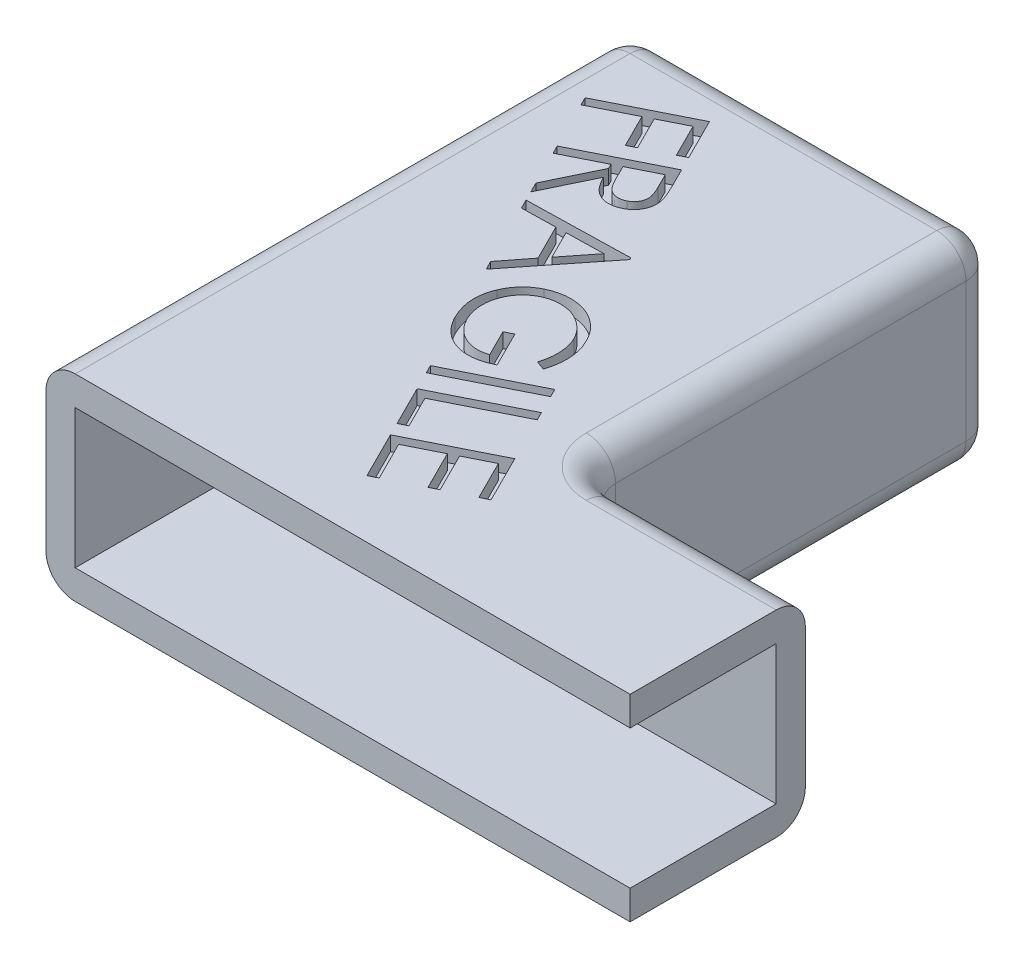
from build123d import *

# Parameters (mm, degrees)
BOSS_EXTRUDE1_DEPTH = 6.75
CUT_EXTRUDE3_DEPTH  = 4.75
CUT_EXTRUDE4_DEPTH  = 1
FILLET1_R           = 2


with BuildPart() as part:
    # Sketch1 → Boss-Extrude1 (new body)
    with BuildSketch(Plane(origin=(0, 0, 0), x_dir=(1, 0, 0), z_dir=(0, 1, 0))):
        Polygon((0, 0), (0, 40), (25, 40), (25, 12), (40, 12), (40, 0), align=None)
    extrude(amount=BOSS_EXTRUDE1_DEPTH)

    # Sketch4 → Cut-Extrude3 (cut)
    with BuildSketch(Plane(origin=(0, 6.75, 0), x_dir=(1, 0, 0), z_dir=(0, 1, 0))):
        Polygon((2, 0), (2, 38), (23, 38), (23, 10), (40, 10), (40, 0), align=None)
    extrude(amount=-CUT_EXTRUDE3_DEPTH, mode=Mode.SUBTRACT)

    # Mirror2: part across plane


with BuildPart() as part_1:
    add(part.part)
    add(part.part.mirror(Plane(origin=(0, 6.75, 0), x_dir=(0, 0, 1), z_dir=(0, -1, 0))))

    # Sketch5 → Cut-Extrude4 (cut)
    # profile 1 of 7: a face of its own
    with BuildSketch(Plane(origin=(0, 13.5, 0), x_dir=(1, 0, 0), z_dir=(0, 1, 0))):
        Polygon((8.754647989, 36.676441202), (10.178055441, 33.834714439), (9.618359928, 33.554866683), (8.476072268, 35.834353862), (6.70285512, 34.946473253), (7.845142781, 32.666986074), (7.286719303, 32.387138317), (6.144431643, 34.666625497), (3.363762572, 33.273746891), (3.082642781, 33.835986474), align=None)
    # profile 2 of 7: a face of its own
    with BuildSketch(Plane(origin=(0, 13.5, 0), x_dir=(1, 0, 0), z_dir=(0, 1, 0))):
        with BuildLine():
            Line((10.663116633, 32.859503914), (11.229172322, 31.729936606))
            add(Edge.make_bspline(
                [(11.229172322, 31.729936606), (11.266586985, 31.654088797), (11.338147563, 31.509019656), (11.43932601, 31.299868335), (11.527962053, 31.10862173), (11.605323099, 30.935170326), (11.66833747, 30.779069763), (11.721174546, 30.641068423), (11.762750594, 30.521309586), (11.782478155, 30.446146264), (11.791411905, 30.41210808)],
                knots=[0, 0, 0, 0, 1.41450932, 2.705439416, 3.885743353, 4.939894687, 5.88148064, 6.700709836, 7.411608266, 8, 8, 8, 8], degree=3))
            add(Edge.make_bspline(
                [(11.791411905, 30.41210808), (11.802078497, 30.365630207), (11.823164297, 30.273752393), (11.838529948, 30.134733419), (11.845179328, 29.997925908), (11.842052212, 29.862526855), (11.82519631, 29.728870174), (11.796602124, 29.59723127), (11.758960623, 29.467152066), (11.708795108, 29.34027056), (11.650082636, 29.216822164), (11.578255624, 29.100872669), (11.496173347, 28.992182486), (11.404631487, 28.890039122), (11.301895564, 28.795763665), (11.189713099, 28.707401745), (11.066119773, 28.627110327), (10.977709577, 28.580939966), (10.932788107, 28.557480677)],
                knots=[0, 0, 0, 0, 1.030585874, 2.037270015, 3.019599379, 3.992076591, 4.962346036, 5.928228341, 6.903253401, 7.887592627, 8.876066943, 9.855953285, 10.831711236, 11.818738111, 12.818127647, 13.843641548, 14.904348217, 16, 16, 16, 16], degree=3))
            add(Edge.make_bspline(
                [(10.932788107, 28.557480677), (10.856454784, 28.522262049), (10.707628602, 28.453596704), (10.473952914, 28.388384974), (10.240978344, 28.357148809), (10.009394291, 28.360860036), (9.782806133, 28.399022554), (9.564210464, 28.47223192), (9.356563374, 28.581115364), (9.192877181, 28.697721344), (9.067809177, 28.809883022), (8.972867756, 28.90747829), (8.879484633, 29.0179465), (8.786870292, 29.140762985), (8.693027373, 29.274443582), (8.602772322, 29.422432801), (8.510240394, 29.581209607), (8.452657249, 29.69312905), (8.423062546, 29.750649747)],
                knots=[0, 0, 0, 0, 1.275491154, 2.486810117, 3.669320756, 4.835400704, 5.991815185, 7.146793527, 8.32226535, 9.541335358, 10.189151225, 10.872441073, 11.608160371, 12.3850279, 13.208790561, 14.088244423, 15.017458352, 16, 16, 16, 16], degree=3))
            Line((8.423062546, 29.750649747), (6.807577771, 26.391204635))
            Line((6.807577771, 26.391204635), (6.45649604, 27.092096061))
            Line((6.45649604, 27.092096061), (8.074524886, 30.448997103))
            Line((8.074524886, 30.448997103), (7.911704373, 30.773366093))
            Line((7.911704373, 30.773366093), (5.274775287, 29.452993497))
            Line((5.274775287, 29.452993497), (4.991111425, 30.019049186))
            Line((4.991111425, 30.019049186), (10.663116633, 32.859503914))
        make_face()
        with BuildLine():
            Line((10.390901088, 32.014872503), (8.463767675, 31.050669779))
            Line((8.463767675, 31.050669779), (8.944597001, 30.071202632))
            add(Edge.make_bspline(
                [(8.944597001, 30.071202632), (8.967576086, 30.025652442), (9.012186541, 29.937223562), (9.082335332, 29.812210508), (9.149400048, 29.697211119), (9.215632114, 29.593373224), (9.281604355, 29.501287469), (9.345213553, 29.418592172), (9.408469027, 29.347945758), (9.488986395, 29.26818611), (9.595471686, 29.187177825), (9.73147041, 29.111276193), (9.877342294, 29.059576057), (10.029147171, 29.030867772), (10.184498247, 29.023712426), (10.338901778, 29.043049787), (10.49173409, 29.081153967), (10.587800696, 29.125346571), (10.636403892, 29.147705036)],
                knots=[0, 0, 0, 0, 1.114428451, 2.163496172, 3.130994844, 4.022616522, 4.852843401, 5.605155819, 6.30056977, 6.922856548, 8.078968302, 9.210815528, 10.312466522, 11.444275841, 12.575326779, 13.694442081, 14.833543843, 16, 16, 16, 16], degree=3))
            add(Edge.make_bspline(
                [(10.636403892, 29.147705036), (10.682233319, 29.172610636), (10.772650602, 29.221747116), (10.892059351, 29.319083053), (10.994641245, 29.432382187), (11.080552506, 29.559146488), (11.148865679, 29.69558941), (11.191294371, 29.839107224), (11.214728754, 29.985543074), (11.211325068, 30.110694902), (11.198057955, 30.216416148), (11.178287168, 30.304628708), (11.151505117, 30.401967801), (11.115496795, 30.50758511), (11.070559549, 30.621825876), (11.01824134, 30.745185499), (10.95866008, 30.877828215), (10.914010652, 30.968131486), (10.890810944, 31.015052792)],
                knots=[0, 0, 0, 0, 1.162087497, 2.292692764, 3.418137779, 4.562520382, 5.700979498, 6.808619015, 7.889994426, 8.997350933, 9.588933592, 10.266395831, 11.012550037, 11.841485571, 12.75530961, 13.75187071, 14.831878838, 16, 16, 16, 16], degree=3))
            Line((10.890810944, 31.015052792), (10.390901088, 32.014872503))
        make_face(mode=Mode.SUBTRACT)
    # profile 3 of 7: a face of its own
    with BuildSketch(Plane(origin=(0, 13.5, 0), x_dir=(1, 0, 0), z_dir=(0, 1, 0))):
        Polygon((14.210861413, 25.767830459), (9.864316942, 20.281542398), (9.559028481, 20.890847286), (10.978619827, 22.716217878), (9.75492191, 25.161069641), (7.444905884, 25.112732302), (7.128169106, 25.744933824), (14.140899474, 25.906482302), align=None)
        Polygon((12.973171109, 25.233575651), (10.430372631, 25.181422205), (11.400935532, 23.241568439), align=None, mode=Mode.SUBTRACT)
    # profile 4 of 7: a face of its own
    with BuildSketch(Plane(origin=(0, 13.5, 0), x_dir=(1, 0, 0), z_dir=(0, 1, 0))):
        with BuildLine():
            Line((17.750596673, 16.310926045), (17.114579045, 16.542436461))
            add(Edge.make_bspline(
                [(17.114579045, 16.542436461), (17.149504314, 16.659314385), (17.218383693, 16.889820228), (17.281073393, 17.241206897), (17.310888701, 17.589529275), (17.307254009, 17.93290052), (17.271246017, 18.265225386), (17.210000777, 18.582208617), (17.11787488, 18.880202133), (17.033022024, 19.066098534), (16.991191625, 19.157740949)],
                knots=[0, 0, 0, 0, 1.090643464, 2.150959598, 3.186474562, 4.214576681, 5.217906055, 6.17316086, 7.099412641, 8, 8, 8, 8], degree=3))
            add(Edge.make_bspline(
                [(16.991191625, 19.157740949), (16.962702997, 19.212451788), (16.905784408, 19.321760799), (16.80702033, 19.477218985), (16.701772172, 19.62730822), (16.585112078, 19.768760942), (16.459449985, 19.903527569), (16.323882955, 20.030877731), (16.18025152, 20.151910087), (16.028317088, 20.264726825), (15.869967846, 20.367022324), (15.707955581, 20.459247033), (15.542779408, 20.539409323), (15.374179228, 20.607467496), (15.20213136, 20.661642415), (15.027695946, 20.705542814), (14.849879754, 20.735777125), (14.670146272, 20.754770336), (14.490442881, 20.762258655), (14.312740681, 20.759117414), (14.138654213, 20.741760214), (13.96769399, 20.715634301), (13.800255752, 20.677127853), (13.635877855, 20.627236557), (13.473990084, 20.566840744), (13.36978921, 20.517060522), (13.317553805, 20.492105933)],
                knots=[0, 0, 0, 0, 1.023602203, 2.045096457, 3.054881536, 4.065255296, 5.086240082, 6.112042517, 7.151234627, 8.202916022, 9.251412248, 10.279072739, 11.295972597, 12.297257131, 13.294599634, 14.288233837, 15.281169632, 16.286306795, 17.286774449, 18.265460265, 19.234171694, 20.188946326, 21.134961851, 22.083618823, 23.03932717, 24, 24, 24, 24], degree=3))
            add(Edge.make_bspline(
                [(13.317553805, 20.492105933), (13.265012063, 20.464386326), (13.160538746, 20.409269019), (13.011184451, 20.314614923), (12.86960337, 20.209598543), (12.734439954, 20.095751059), (12.608667975, 19.969877214), (12.48847915, 19.836036479), (12.375376993, 19.692769005), (12.271423389, 19.539846683), (12.176260736, 19.380990231), (12.093260228, 19.215901412), (12.022126656, 19.046672178), (11.961899259, 18.87296044), (11.913866024, 18.694808579), (11.876440376, 18.512654363), (11.852785005, 18.325965406), (11.839712647, 18.13609188), (11.840164955, 17.944464904), (11.851489102, 17.753747561), (11.874222673, 17.564591967), (11.909936061, 17.377168793), (11.95877478, 17.191307097), (12.018470291, 17.006340907), (12.090728404, 16.823197938), (12.147829948, 16.704084473), (12.17653818, 16.644199282)],
                knots=[0, 0, 0, 0, 0.958373364, 1.905617186, 2.849890808, 3.801351144, 4.754507599, 5.718798181, 6.703007822, 7.697486439, 8.700800039, 9.689186917, 10.676602268, 11.661168615, 12.653762319, 13.652140774, 14.6595524, 15.688188091, 16.721387899, 17.749591108, 18.76972591, 19.793639978, 20.825910435, 21.868874541, 22.928560625, 24, 24, 24, 24], degree=3))
            add(Edge.make_bspline(
                [(12.17653818, 16.644199282), (12.214068842, 16.573210328), (12.287728414, 16.433883826), (12.414425786, 16.238536676), (12.551922826, 16.059542055), (12.701594428, 15.897175895), (12.862463217, 15.750363869), (13.033905288, 15.618831466), (13.217610105, 15.505286505), (13.40963089, 15.407416669), (13.609218029, 15.329024262), (13.811266617, 15.268846856), (14.015281353, 15.228719872), (14.220684515, 15.210139851), (14.427703659, 15.20964635), (14.635926564, 15.230631866), (14.845713573, 15.270770388), (14.983003471, 15.313573624), (15.052609894, 15.335275003)],
                knots=[0, 0, 0, 0, 1.112233068, 2.182924723, 3.221773303, 4.236313444, 5.23858161, 6.236241304, 7.225841215, 8.226937701, 9.218680529, 10.192811497, 11.144573681, 12.094593375, 13.046391827, 14.00866825, 14.990388358, 16, 16, 16, 16], degree=3))
            Line((15.052609894, 15.335275003), (14.146920792, 17.144109138))
            Line((14.146920792, 17.144109138), (14.693895952, 17.417596718))
            Line((14.693895952, 17.417596718), (15.917593869, 14.972744955))
            add(Edge.make_bspline(
                [(15.917593869, 14.972744955), (15.809404304, 14.922139968), (15.597668067, 14.823101676), (15.273973467, 14.708923582), (14.955243401, 14.626351182), (14.641771554, 14.575796604), (14.332683177, 14.559255718), (14.028543225, 14.573883546), (13.729228934, 14.622974686), (13.436783511, 14.703160629), (13.154432621, 14.813130912), (12.887790624, 14.95440471), (12.63554354, 15.121796471), (12.40192406, 15.320796978), (12.181321881, 15.545432969), (11.979433242, 15.800315708), (11.792388421, 16.082452493), (11.684673999, 16.285767958), (11.629563019, 16.389792231)],
                knots=[0, 0, 0, 0, 1.124394106, 2.200535496, 3.227236646, 4.221905612, 5.185737163, 6.137396387, 7.084115907, 8.036453592, 8.988657298, 9.931841074, 10.873298585, 11.834072463, 12.816829376, 13.834050308, 14.891814057, 16, 16, 16, 16], degree=3))
            add(Edge.make_bspline(
                [(11.629563019, 16.389792231), (11.59807253, 16.454836715), (11.535695827, 16.583677538), (11.452653598, 16.778988393), (11.383722316, 16.974646212), (11.320983228, 17.167352218), (11.273924762, 17.360779491), (11.232949137, 17.552145043), (11.20728087, 17.743568268), (11.189884775, 17.933275604), (11.18540867, 18.122306132), (11.189859413, 18.310480344), (11.206966479, 18.497711886), (11.23344002, 18.684237249), (11.271540457, 18.869925547), (11.321796107, 19.054363442), (11.380801453, 19.238289596), (11.429503602, 19.358160508), (11.454022154, 19.418508176)],
                knots=[0, 0, 0, 0, 1.10581367, 2.190407767, 3.245347638, 4.279611866, 5.289928162, 6.290130256, 7.272901491, 8.243365102, 9.204018092, 10.164671082, 11.122207412, 12.079281966, 13.046399366, 14.020673147, 15.003530055, 16, 16, 16, 16], degree=3))
            add(Edge.make_bspline(
                [(11.454022154, 19.418508176), (11.494636157, 19.509728982), (11.574858158, 19.689911062), (11.725201022, 19.941979792), (11.88968972, 20.178590118), (12.075466342, 20.39629856), (12.28112837, 20.594628863), (12.504527997, 20.776758878), (12.748532732, 20.938649372), (12.922010676, 21.031545715), (13.009721272, 21.078514186)],
                knots=[0, 0, 0, 0, 1.029893183, 2.034275993, 3.023912036, 4.001864804, 4.983063865, 5.96944254, 6.973348412, 8, 8, 8, 8], degree=3))
            add(Edge.make_bspline(
                [(13.009721272, 21.078514186), (13.07714227, 21.110848767), (13.210546799, 21.174828532), (13.417014701, 21.253523183), (13.62597772, 21.318816897), (13.838131288, 21.369279427), (14.052566323, 21.406942951), (14.269848042, 21.428027021), (14.489943074, 21.436121225), (14.711742769, 21.428000667), (14.93269239, 21.406641379), (15.150289788, 21.371091726), (15.363231796, 21.321452252), (15.571027309, 21.257639736), (15.774439491, 21.17997239), (15.972277168, 21.086472623), (16.166826566, 20.981217404), (16.354379655, 20.859824633), (16.535918218, 20.727160676), (16.708486832, 20.581371766), (16.871263362, 20.42330867), (17.025319533, 20.253691435), (17.171152684, 20.072973447), (17.305305233, 19.878738793), (17.432308337, 19.674314335), (17.506872023, 19.530545212), (17.544526962, 19.457941269)],
                knots=[0, 0, 0, 0, 1.001409127, 1.981467476, 2.957103692, 3.932607596, 4.901073092, 5.871602272, 6.854947762, 7.849647827, 8.842789463, 9.827118954, 10.801315311, 11.769847447, 12.737262772, 13.715673409, 14.699478222, 15.698516039, 16.706317444, 17.71006013, 18.722430057, 19.74384414, 20.778286389, 21.830973086, 22.90463333, 24, 24, 24, 24], degree=3))
            add(Edge.make_bspline(
                [(17.544526962, 19.457941269), (17.600687062, 19.337644206), (17.711783556, 19.099671305), (17.836788123, 18.728447901), (17.921565009, 18.351526154), (17.963525295, 18.033035785), (17.974482571, 17.775139185), (17.975278079, 17.577287318), (17.96321043, 17.375637243), (17.941430886, 17.169795592), (17.909624725, 16.960542021), (17.867540648, 16.746972509), (17.813806472, 16.52995476), (17.771850234, 16.384571908), (17.750596673, 16.310926045)],
                knots=[0, 0, 0, 0, 1.475369076, 2.918590448, 4.34484701, 5.765880787, 6.483274427, 7.214052629, 7.964889576, 8.728175752, 9.51497962, 10.317559171, 11.147734369, 12, 12, 12, 12], degree=3))
        make_face()
    # profile 5 of 7: a face of its own
    with BuildSketch(Plane(origin=(0, 13.5, 0), x_dir=(1, 0, 0), z_dir=(0, 1, 0))):
        Polygon((19.345012717, 15.495711746), (19.628676579, 14.928384022), (13.956671371, 12.087929294), (13.673007508, 12.655257018), align=None)
    # profile 6 of 7: a face of its own
    with BuildSketch(Plane(origin=(0, 13.5, 0), x_dir=(1, 0, 0), z_dir=(0, 1, 0))):
        Polygon((20.259504408, 13.666728363), (20.544440306, 13.096856568), (15.419410258, 10.52988942), (16.510816508, 8.350893026), (15.963841348, 8.077405446), (14.5874992, 10.826273635), align=None)
    # profile 7 of 7: a face of its own
    with BuildSketch(Plane(origin=(0, 13.5, 0), x_dir=(1, 0, 0), z_dir=(0, 1, 0))):
        Polygon((22.081165118, 10.022134909), (23.709370246, 6.772084829), (23.149674733, 6.492237072), (21.805133467, 9.176231463), (20.03191632, 8.288350854), (21.365009268, 5.627253098), (20.810401897, 5.348677377), (19.477308948, 8.009775133), (17.252519284, 6.895472249), (18.585612233, 4.234374492), (18.02591672, 3.954526736), (16.409159909, 7.181680181), align=None)
    extrude(amount=-CUT_EXTRUDE4_DEPTH, mode=Mode.SUBTRACT)

    # Fillet1
    fillet1_edges = [part_1.edges().sort_by_distance(p)[0] for p in [
        (32.5, 0, -12),
        (32.5, 13.5, -12),
        (25, 6.75, -12),
        (25, 13.5, -26),
        (25, 0, -26),
        (12.5, 0, -40),
        (0, 0, -20),
        (0, 6.75, -40),
        (0, 13.5, -20),
        (12.5, 13.5, -40),
        (25, 6.75, -40),
        (23, 6.75, -10),
    ]]
    fillet(fillet1_edges, radius=FILLET1_R)


solid = part_1.part
